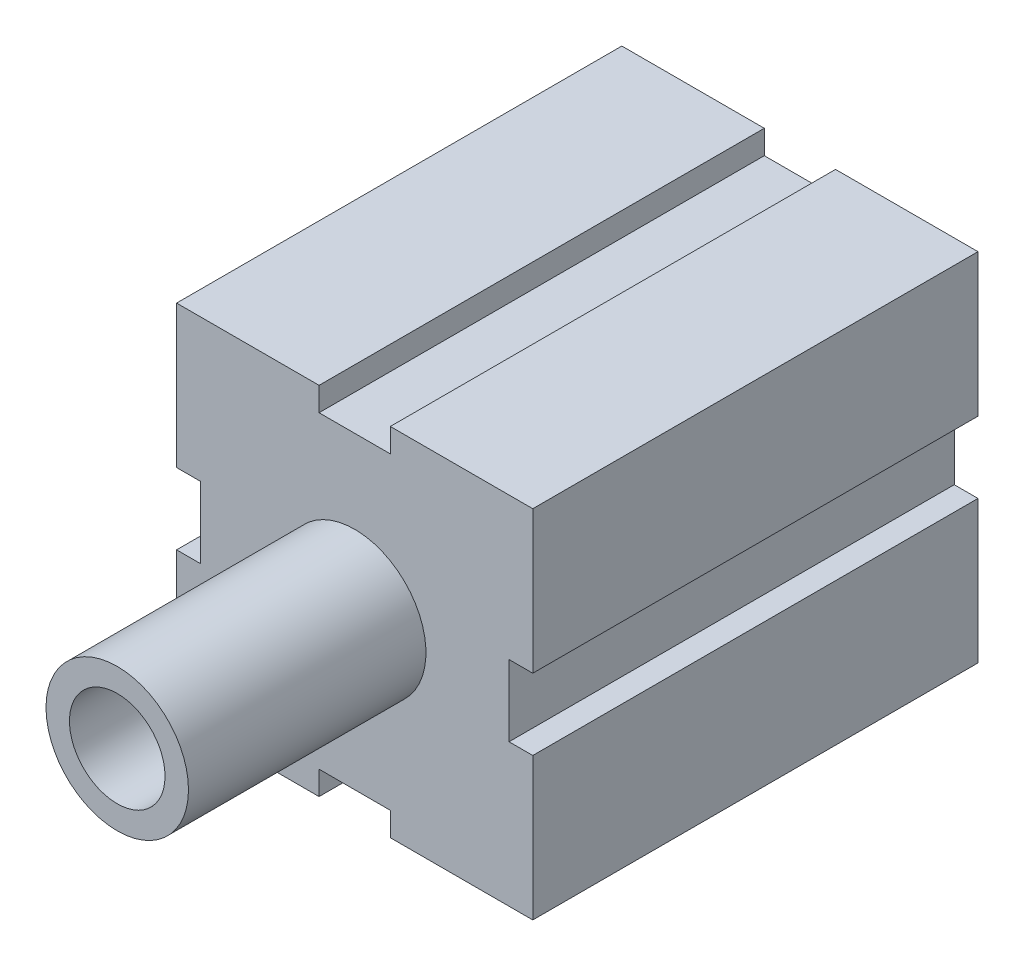
from build123d import *

# Parameters (mm, degrees)
SKETCH1_W           = 30
SKETCH1_H           = 30
BOSS_EXTRUDE1_DEPTH = 37.5
SKETCH2_R           = 6
SKETCH2_R_2         = 4.025
BOSS_EXTRUDE2_DEPTH = 20
CUT_EXTRUDE1_START  = -20
SKETCH3_R           = 4.025
CUT_EXTRUDE1_DEPTH  = 20
SKETCH4_W           = 6
SKETCH4_H           = 75
CUT_EXTRUDE2_DEPTH  = 2
CIRPATTERN1_COUNT   = 4


with BuildPart() as part:
    # Sketch1 → Boss-Extrude1 (new body)
    with BuildSketch(Plane.XY):
        with Locations((317.864943501, 92.549790439)):
            Rectangle(SKETCH1_W, SKETCH1_H)
    extrude(amount=BOSS_EXTRUDE1_DEPTH)

    # Sketch2 → Boss-Extrude2 (add)
    with BuildSketch(Plane.XY.offset(37.5)):
        with Locations((317.864943501, 92.549790439)):
            Circle(SKETCH2_R)
        with Locations((317.864943501, 92.549790439)):
            Circle(SKETCH2_R_2, mode=Mode.SUBTRACT)
    extrude(amount=BOSS_EXTRUDE2_DEPTH)

    # Sketch3 → Cut-Extrude1 (cut)
    with BuildSketch(Plane.XY.offset(37.5).offset(CUT_EXTRUDE1_START)):
        with Locations((317.864943501, 92.549790439)):
            Circle(SKETCH3_R)
    extrude(amount=CUT_EXTRUDE1_DEPTH, mode=Mode.SUBTRACT)

    # Sketch4 → Cut-Extrude2 (cut)
    with BuildSketch(Plane.XZ.offset(-77.549790439)):
        with Locations((317.864943501, 0)):
            Rectangle(SKETCH4_W, SKETCH4_H)
    cut_extrude2 = extrude(amount=-CUT_EXTRUDE2_DEPTH, mode=Mode.SUBTRACT)

    # CirPattern1: Cut-Extrude2 ×4 about axis
    cirpattern1_axis = Axis((317.864943501, 92.549790439, 17.5), (0, 0, 1))
    for i in range(1, CIRPATTERN1_COUNT):
        add(cut_extrude2.rotate(cirpattern1_axis, i * 360 / CIRPATTERN1_COUNT), mode=Mode.SUBTRACT)


solid = part.part
